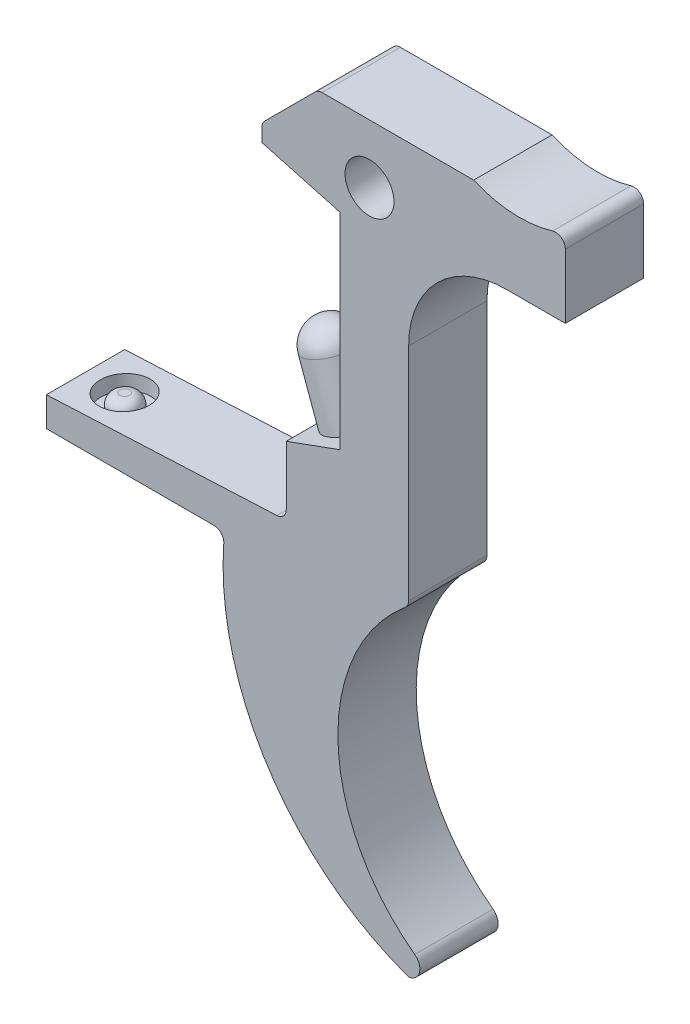
from build123d import *

# Parameters (mm, degrees)
SKETCH_1_R          = 2.5
EXTRUDE_1_DEPTH     = 8
FILLET_8_R          = 1
SKETCH_2_R          = 2.5
EXTRUDE_2_DEPTH     = 2.5
FILLET_7_R          = 2.5
SKETCH_3_R          = 2.5
EXTRUDE_3_DEPTH     = 8.7
FILLET_4_R          = 2.5
FILLET_5_R          = 1
FILLET_6_R          = 1
SKETCH_4_R          = 2.5
CUT_EXTRUDE_1_DEPTH = 3
SKETCH_5_R          = 2.5
CUT_EXTRUDE_2_DEPTH = 1.5
SKETCH_7_R          = 1.5
EXTRUDE_4_DEPTH     = 1.5
FILLET_9_R          = 1


with BuildPart() as part:
    # 스케치1 → 보스-돌출1 (new body)
    with BuildSketch(Plane.XY):
        with BuildLine():
            Line((-11, 0.25), (-5.25, 6))
            Line((-5.25, 6), (10.645895628, 6))
            ThreePointArc((10.645895628, 6), (15.322947814, 5.028470802), (20, 6))
            Line((20, 6), (20, -2))
            Line((20, -2), (14, -2))
            ThreePointArc((14, -2), (6.928932188, -4.928932188), (4, -12))
            Line((4, -12), (4, -35))
            ThreePointArc((4, -35), (-3.221957743, -50.400925483), (4.620254931, -65.495456935))
            ThreePointArc((4.620254931, -65.495456935), (5.101546116, -66.864569331), (4.000000416, -67.809401077))
            ThreePointArc((4.000000416, -67.809401077), (-10.595076269, -56.067028756), (-14.785374908, -37.809401077))
            Line((-14.785374908, -37.809401077), (-33, -37.809401077))
            Line((-33, -37.809401077), (-33, -34.809401077))
            Line((-33, -34.809401077), (-8.5, -33.675426481))
            Line((-8.5, -33.675426481), (-8.5, -26.675426481))
            Line((-8.5, -26.675426481), (-3, -24.673590192))
            Line((-3, -24.673590192), (-3, -3.673590192))
            Line((-3, -3.673590192), (-11, -1.493890685))
            Line((-11, -1.493890685), (-11, 0.25))
        make_face()
        Circle(SKETCH_1_R, mode=Mode.SUBTRACT)
    extrude(amount=EXTRUDE_1_DEPTH)

    # 필렛8
    fillet_8_edges = [part.edges().sort_by_distance(p)[0] for p in [
        (4, -35, 4),
        (-14.785374908, -37.809401077, 4),
        (-8.5, -33.675426481, 4),
    ]]
    fillet(fillet_8_edges, radius=FILLET_8_R)

    # 스케치2 → 보스-돌출2 (add)
    with BuildSketch(Plane.ZY.offset(3)):
        with Locations(Location((4, -9.673590192, 0), (0, 0, 90))):
            Circle(SKETCH_2_R)
    extrude(amount=EXTRUDE_2_DEPTH)

    # 필렛7
    fillet_7_edges = [part.edges().sort_by_distance(p)[0] for p in [
        (-5.5, -12.173590192, 4),
    ]]
    fillet(fillet_7_edges, radius=FILLET_7_R - 0.0001)  # a hair under: the kernel refuses the full size

    # 스케치3 → 보스-돌출3 (add)
    with BuildSketch(Plane(origin=(7.579005696, -20.823147011, 0), x_dir=(0.9396926207859105, 0.34202014332566305, 0), z_dir=(-0.34202014332566305, 0.9396926207859105, 0))):
        with Locations((-14.184431591, -4)):
            Circle(SKETCH_3_R)
    extrude(amount=EXTRUDE_3_DEPTH)

    # 필렛4
    fillet_4_edges = [part.edges().sort_by_distance(p)[0] for p in [
        (-11.074806799, -18.354232894, 4),
    ]]
    fillet(fillet_4_edges, radius=FILLET_4_R)

    # 필렛5
    fillet_5_edges = [part.edges().sort_by_distance(p)[0] for p in [
        (20, 6, 4),
    ]]
    fillet(fillet_5_edges, radius=FILLET_5_R)

    # 필렛6
    fillet_6_edges = [part.edges().sort_by_distance(p)[0] for p in [
        (-11, 0.25, 4),
        (-5.25, 6, 4),
    ]]
    fillet(fillet_6_edges, radius=FILLET_6_R)

    # 스케치4 → 컷-돌출1 (cut)
    with BuildSketch(Plane.XZ.offset(2)):
        with Locations(Location((16.726046575, 4, 0), (0, 0, 270))):
            Circle(SKETCH_4_R)
    extrude(amount=-CUT_EXTRUDE_1_DEPTH, mode=Mode.SUBTRACT)

    # 스케치5 → 컷-돌출2 (cut)
    with BuildSketch(Plane(origin=(1.537153943, -33.210860048, 0), x_dir=(0.9989305822499971, 0.046235179740992706, 0), z_dir=(-0.046235179740992706, 0.9989305822499971, 0))):
        with Locations(Location((-30.57412813, -4, 0), (0, 0, 180))):
            Circle(SKETCH_5_R)
    extrude(amount=-CUT_EXTRUDE_2_DEPTH, mode=Mode.SUBTRACT)

    # 스케치7 → 보스-돌출4 (add)
    with BuildSketch(Plane(origin=(1.606506713, -34.709255922, 0), x_dir=(0.9989305822499971, 0.04623517974099271, 0), z_dir=(-0.04623517974099271, 0.9989305822499971, 0))):
        with Locations(Location((-30.57412813, -4, 0), (0, 0, 180))):
            Circle(SKETCH_7_R)
    extrude(amount=EXTRUDE_4_DEPTH)

    # 필렛9
    fillet_9_edges = [part.edges().sort_by_distance(p)[0] for p in [
        (-27.505881798, -34.555107588, 4),
    ]]
    fillet(fillet_9_edges, radius=FILLET_9_R)


solid = part.part
